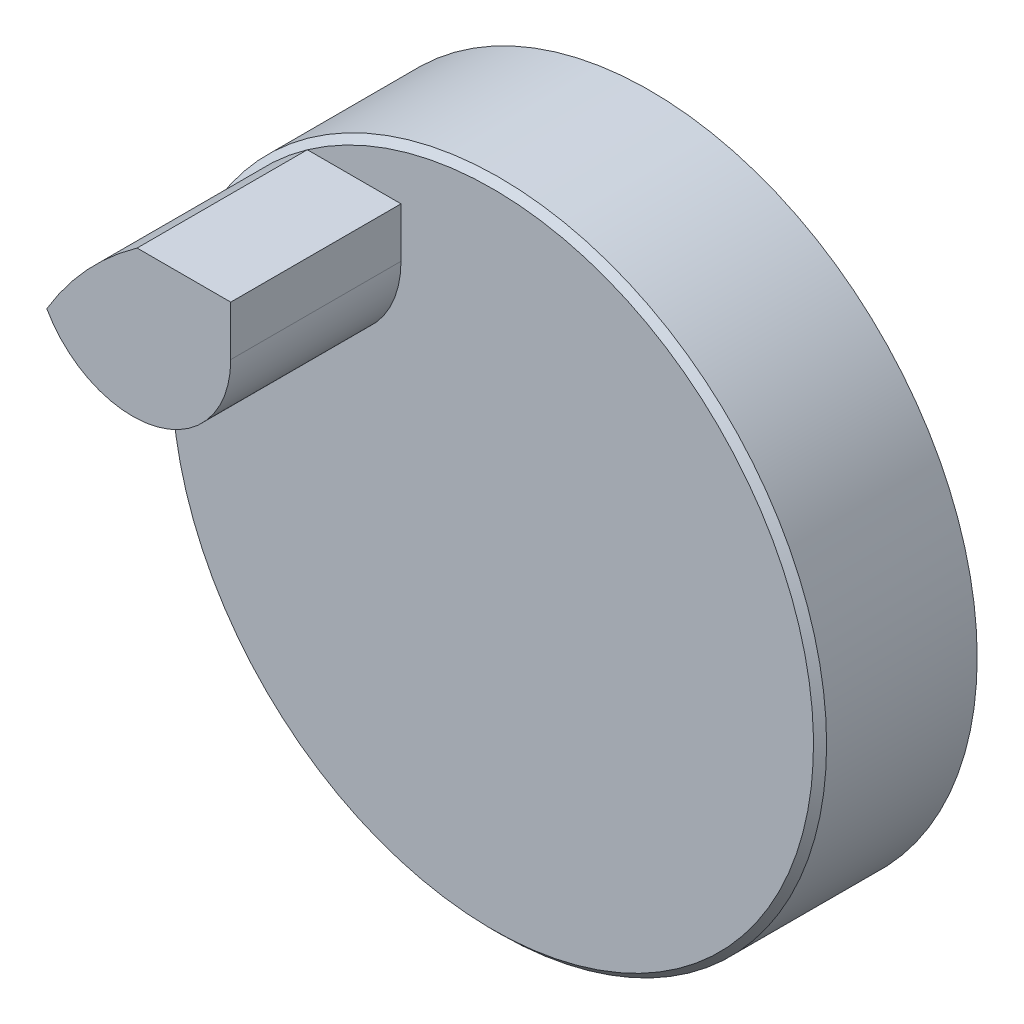
from build123d import *

# Parameters (mm, degrees)
SKETCH1_R           = 25
BOSS_EXTRUDE1_DEPTH = 12
CHAMFER1_SIZE       = 0.5
BOSS_EXTRUDE2_DEPTH = 13
SKETCH4_R           = 4.25
CUT_EXTRUDE1_DEPTH  = 6
CIRPATTERN1_COUNT   = 5


with BuildPart() as part:
    # Sketch1 → Boss-Extrude1 (new body)
    with BuildSketch(Plane.XY):
        Circle(SKETCH1_R)
    extrude(amount=BOSS_EXTRUDE1_DEPTH)

    # Chamfer1
    chamfer1_edges = [part.edges().sort_by_distance(p)[0] for p in [
        (-25, 0, 12),
    ]]
    chamfer(chamfer1_edges, length=CHAMFER1_SIZE)

    # Sketch2 → Boss-Extrude2 (add)
    with BuildSketch(Plane.XY.offset(12)):
        with BuildLine():
            Line((-7, 20), (-14.150971698, 20))
            ThreePointArc((-14.150971698, 20), (-17.989766791, 16.631845682), (-21.046908053, 12.541039089))
            ThreePointArc((-21.046908053, 12.541039089), (-12.609472348, 8.942183166), (-7, 16.2))
            Line((-7, 16.2), (-7, 20))
        make_face()
    extrude(amount=BOSS_EXTRUDE2_DEPTH)

    # Sketch4 → Cut-Extrude1 (cut)
    with BuildSketch(Plane(origin=(0, 0, 0), x_dir=(-1, 0, 0), z_dir=(0, 0, -1))):
        with Locations((0, 17.5)):
            Circle(SKETCH4_R)
    cut_extrude1 = extrude(amount=-CUT_EXTRUDE1_DEPTH, mode=Mode.SUBTRACT)

    # CirPattern1: Cut-Extrude1 ×5 about axis
    cirpattern1_axis = Axis((0, 0, 0), (0, 0, 1))
    for i in range(1, CIRPATTERN1_COUNT):
        add(cut_extrude1.rotate(cirpattern1_axis, i * 360 / CIRPATTERN1_COUNT), mode=Mode.SUBTRACT)


solid = part.part
